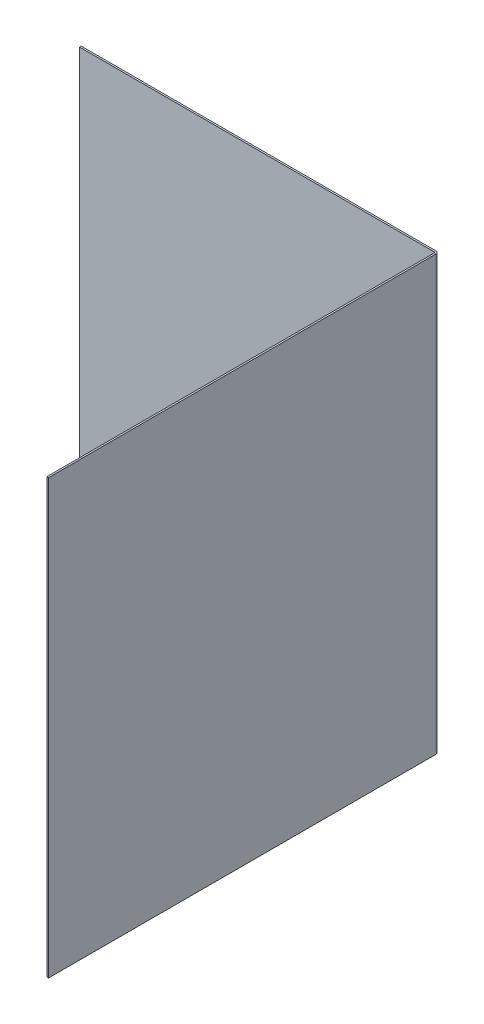
from build123d import *

# Parameters (mm, degrees)
SKETCH1_W                    = 1.5875
SKETCH1_H                    = 400
BASE_FLANGE1_DEPTH           = 330
EDGE_FLANGE1_STRIP_W         = 7.8232
EDGE_FLANGE1_STRIP_H         = 1.5875
EDGE_FLANGE1_STRIP_CUT_DEPTH = 400
EDGE_FLANGE1_DEPTH           = 400


# Sheet-metal steps are written as plain solids
with BuildPart() as part:
    # Sketch1 → Base-Flange1 (new body)
    with BuildSketch(Plane(origin=(0, 0, 0), x_dir=(0, 0, -1), z_dir=(1, 0, 0))):
        with Locations((0.79375, 0)):
            Rectangle(SKETCH1_W, SKETCH1_H)
    extrude(amount=BASE_FLANGE1_DEPTH)

    # Edge-Flange1 strip (across the edge) → Edge-Flange1 strip cut (cut)
    with BuildSketch(Plane(origin=(330, -200, 0), x_dir=(-1, 0, 0), z_dir=(0, 1, 0))):
        with Locations((-1.5875, -0.79375)):
            Rectangle(EDGE_FLANGE1_STRIP_W, EDGE_FLANGE1_STRIP_H)
    extrude(amount=EDGE_FLANGE1_STRIP_CUT_DEPTH, mode=Mode.SUBTRACT)

    # Edge-Flange1 section (across the edge) → Edge-Flange1 (add)
    with BuildSketch(Plane(origin=(330, -200, 0), x_dir=(-1, 0, 0), z_dir=(0, 1, 0))):
        with BuildLine():
            Line((0, 0.7366), (0, 358.4125))
            Line((0, 358.4125), (1.5875, 358.4125))
            Line((1.5875, 358.4125), (1.5875, 0.7366))
            ThreePointArc((1.5875, 0.7366), (1.803245145, 0.215745145), (2.3241, 0))
            Line((2.3241, 0), (2.3241, -1.5875))
            ThreePointArc((2.3241, -1.5875), (0.68071313, -0.90678687), (0, 0.7366))
        make_face()
    extrude(amount=EDGE_FLANGE1_DEPTH)


solid = part.part
